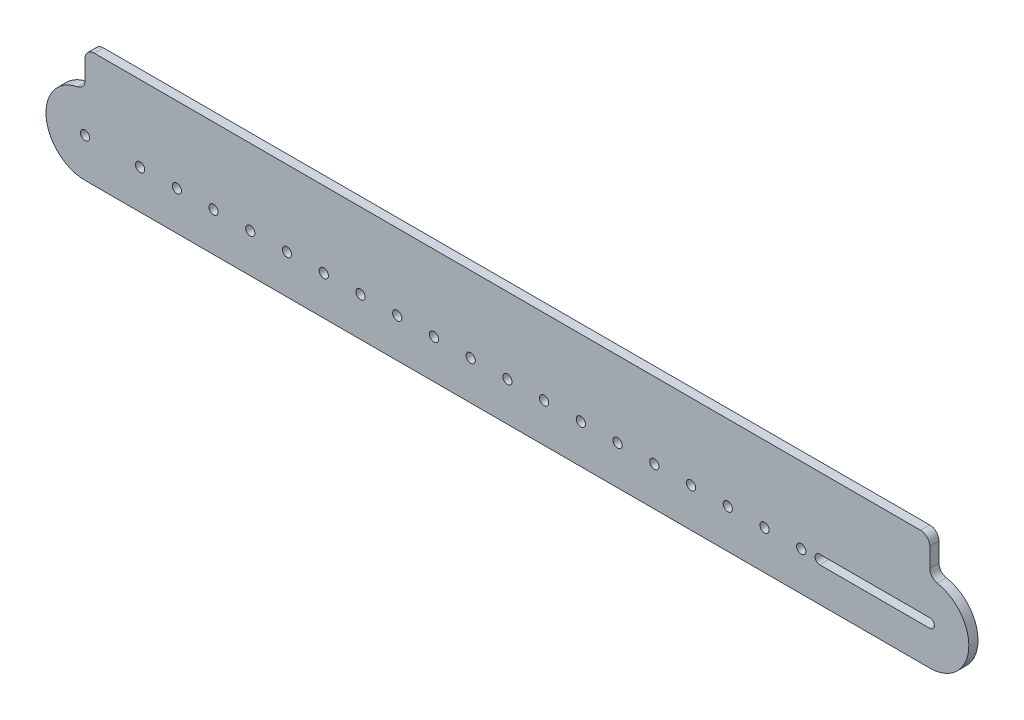
from build123d import *

# Parameters (mm, degrees)
BOSS_EXTRUDE1_DEPTH = 3.175
SKETCH2_R           = 3.175
CUT_EXTRUDE1_DEPTH  = 614.461435473
FILLET1_R           = 6.35


with BuildPart() as part:
    # Sketch1 → Boss-Extrude1 (new, symmetric)
    with BuildSketch(Plane.XY):
        with BuildLine():
            Line((0, 52.3875), (0, 26.9875))
            ThreePointArc((0, 26.9875), (-26.9875, 0), (0, -26.9875))
            Line((0, -26.9875), (584.2, -26.9875))
            ThreePointArc((584.2, -26.9875), (611.1875, 0), (584.2, 26.9875))
            Line((584.2, 26.9875), (584.2, 52.3875))
            Line((584.2, 52.3875), (0, 52.3875))
        make_face()
    extrude(amount=BOSS_EXTRUDE1_DEPTH, both=True)

    # Sketch2 → Cut-Extrude1 (cut, through all)
    with BuildSketch(Plane.XY.offset(3.175)):
        Circle(SKETCH2_R)
        with Locations((38.1, 0)):
            Circle(SKETCH2_R)
        with Locations((63.5, 0)):
            Circle(SKETCH2_R)
        with Locations((88.9, 0)):
            Circle(SKETCH2_R)
        with Locations((114.3, 0)):
            Circle(SKETCH2_R)
        with Locations((139.7, 0)):
            Circle(SKETCH2_R)
        with Locations((165.1, 0)):
            Circle(SKETCH2_R)
        with Locations((190.5, 0)):
            Circle(SKETCH2_R)
        with Locations((215.9, 0)):
            Circle(SKETCH2_R)
        with Locations((241.3, 0)):
            Circle(SKETCH2_R)
        with Locations((266.7, 0)):
            Circle(SKETCH2_R)
        with Locations((292.1, 0)):
            Circle(SKETCH2_R)
        with Locations((317.5, 0)):
            Circle(SKETCH2_R)
        with Locations((342.9, 0)):
            Circle(SKETCH2_R)
        with Locations((368.3, 0)):
            Circle(SKETCH2_R)
        with Locations((393.7, 0)):
            Circle(SKETCH2_R)
        with Locations((419.1, 0)):
            Circle(SKETCH2_R)
        with Locations((444.5, 0)):
            Circle(SKETCH2_R)
        with Locations((469.9, 0)):
            Circle(SKETCH2_R)
        with Locations((495.3, 0)):
            Circle(SKETCH2_R)
        with BuildLine():
            Line((508, 3.175), (584.2, 3.175))
            ThreePointArc((584.2, 3.175), (587.375, 0), (584.2, -3.175))
            Line((584.2, -3.175), (508, -3.175))
            ThreePointArc((508, -3.175), (504.825, 0), (508, 3.175))
        make_face()
    extrude(amount=-CUT_EXTRUDE1_DEPTH, mode=Mode.SUBTRACT)

    # Fillet1
    fillet1_edges = [part.edges().sort_by_distance(p)[0] for p in [
        (0, 26.9875, 0),
        (584.2, 26.9875, 0),
        (584.2, 52.3875, 0),
        (0, 52.3875, 0),
    ]]
    fillet(fillet1_edges, radius=FILLET1_R)


solid = part.part
